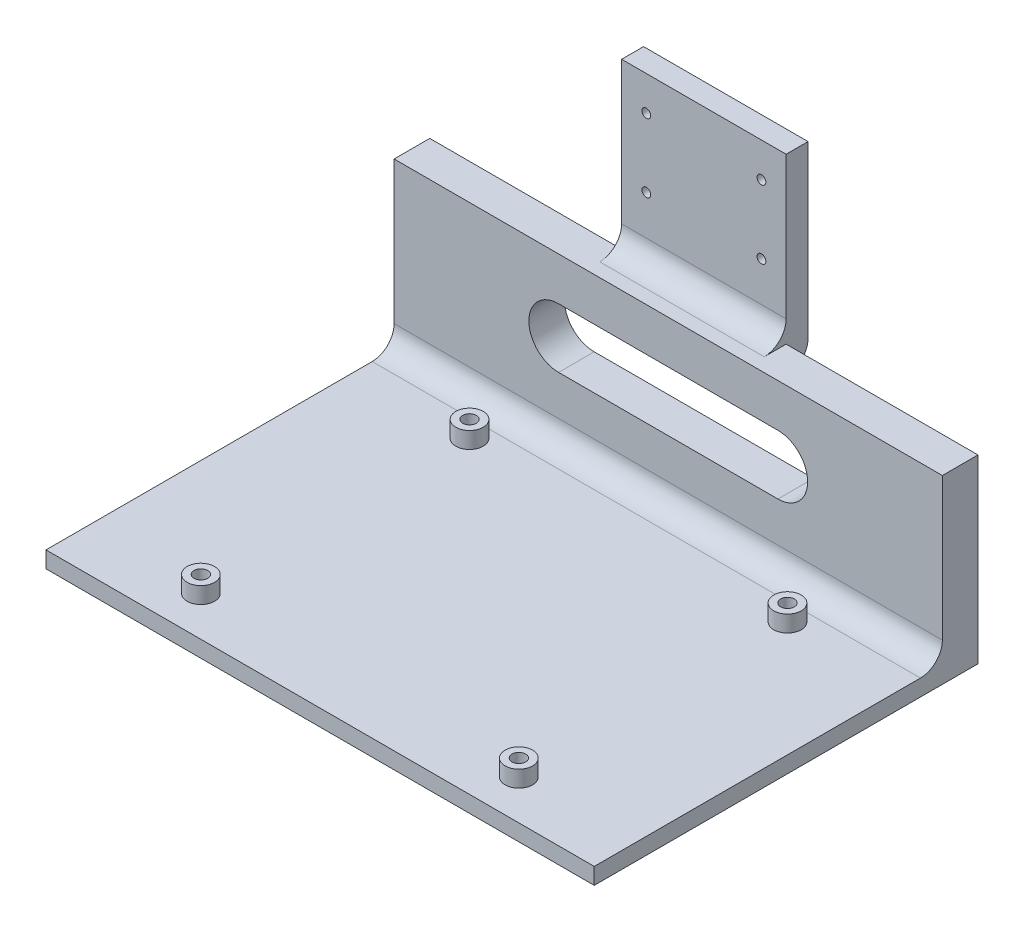
from build123d import *

# Parameters (mm, degrees)
SKETCH1_W                 = 100
SKETCH1_H                 = 70
BOSS_EXTRUDE1_DEPTH       = 3
SKETCH2_W                 = 100
SKETCH2_H                 = 6.5
BOSS_EXTRUDE2_DEPTH       = 30
SKETCH14_R                = 2.5
BOSS_EXTRUDE5_DEPTH       = 3
F_2_5MM_DOWEL_HOLE4_D     = 2.5
SKETCH21_W                = 30
SKETCH21_H                = 4
BOSS_EXTRUDE6_DEPTH       = 4
SKETCH22_W                = 30
SKETCH22_H                = 4
BOSS_EXTRUDE7_DEPTH       = 30
FILLET6_R                 = 4
FILLET7_R                 = 4
FILLET8_R                 = 4
M2X0_4_TAPPED_HOLE1_D     = 1.6
M2X0_4_TAPPED_HOLE1_DEPTH = 13
M2X0_4_TAPPED_HOLE1_TIP   = 0.480688495
FILLET9_R                 = 4
CUT_EXTRUDE10_DEPTH       = 14


with BuildPart() as part:
    # Sketch1 → Boss-Extrude1 (new body)
    with BuildSketch(Plane(origin=(0, 0, 0), x_dir=(1, 0, 0), z_dir=(0, 1, 0))):
        Rectangle(SKETCH1_W, SKETCH1_H)
    extrude(amount=BOSS_EXTRUDE1_DEPTH)

    # Sketch2 → Boss-Extrude2 (add)
    with BuildSketch(Plane(origin=(0, 3, 0), x_dir=(1, 0, 0), z_dir=(0, 1, 0))):
        with Locations((0, 31.75)):
            Rectangle(SKETCH2_W, SKETCH2_H)
    extrude(amount=BOSS_EXTRUDE2_DEPTH)

    # Sketch14 → Boss-Extrude5 (add)
    with BuildSketch(Plane(origin=(0, 3, -3), x_dir=(1, 0, 0), z_dir=(0, -1, 0))):
        with Locations(Location((-29, -18.25, 0), (0, 0, 270))):
            Circle(SKETCH14_R)
        with Locations(Location((-29, 30.75, 0), (0, 0, 270))):
            Circle(SKETCH14_R)
        with Locations(Location((29, -18.25, 0), (0, 0, 270))):
            Circle(SKETCH14_R)
        with Locations(Location((29, 30.75, 0), (0, 0, 270))):
            Circle(SKETCH14_R)
    extrude(amount=-BOSS_EXTRUDE5_DEPTH)

    # Ø2.5mm Dowel Hole4 (through all)
    with Locations(Plane(origin=(0, 6, 0), x_dir=(1, 0, 0), z_dir=(0, 1, 0))):
        with Locations((-29, 21.25), (29, 21.25), (29, -27.75), (-29, -27.75)):
            Hole(F_2_5MM_DOWEL_HOLE4_D / 2)

    # Sketch21 → Boss-Extrude6 (add)
    with BuildSketch(Plane(origin=(0, 0, -35), x_dir=(-1, 0, 0), z_dir=(0, 0, -1))):
        with Locations((0, 31)):
            Rectangle(SKETCH21_W, SKETCH21_H)
    extrude(amount=BOSS_EXTRUDE6_DEPTH)

    # Sketch22 → Boss-Extrude7 (add)
    with BuildSketch(Plane(origin=(0, 33, 0), x_dir=(1, 0, 0), z_dir=(0, 1, 0))):
        with Locations((0, 37)):
            Rectangle(SKETCH22_W, SKETCH22_H)
    extrude(amount=BOSS_EXTRUDE7_DEPTH)

    # Fillet6
    fillet6_edges = [part.edges().sort_by_distance(p)[0] for p in [
        (0, 33, -35),
    ]]
    fillet(fillet6_edges, radius=FILLET6_R)

    # Fillet7
    fillet7_edges = [part.edges().sort_by_distance(p)[0] for p in [
        (0, 29, -35),
    ]]
    fillet(fillet7_edges, radius=FILLET7_R - 0.0001)  # a hair under: the kernel refuses the full size

    # Fillet8
    fillet8_edges = [part.edges().sort_by_distance(p)[0] for p in [
        (0, 29, -39),
    ]]
    fillet(fillet8_edges, radius=FILLET8_R)

    # M2x0.4 Tapped Hole1
    with Locations(Plane(origin=(0, 0, -39), x_dir=(-1, 0, 0), z_dir=(0, 0, -1))):
        with Locations((-10.5, 56.728604695), (10.5, 56.728604695), (10.5, 44.228604695), (-10.5, 44.228604695)):
            Hole(M2X0_4_TAPPED_HOLE1_D / 2, depth=M2X0_4_TAPPED_HOLE1_DEPTH)
            with Locations((0, 0, -(M2X0_4_TAPPED_HOLE1_DEPTH + M2X0_4_TAPPED_HOLE1_TIP / 2))):  # 118° drill point
                Cone(0, M2X0_4_TAPPED_HOLE1_D / 2, M2X0_4_TAPPED_HOLE1_TIP, mode=Mode.SUBTRACT)

    # Fillet9
    fillet9_edges = [part.edges().sort_by_distance(p)[0] for p in [
        (0, 3, -28.5),
    ]]
    fillet(fillet9_edges, radius=FILLET9_R)

    # Sketch28 → Cut-Extrude10 (cut)
    with BuildSketch(Plane.XY.offset(-28.5)):
        with BuildLine():
            Line((-20, 25.135697653), (20, 25.135697653))
            ThreePointArc((20, 25.135697653), (25.424121319, 19.711576334), (20, 14.287455015))
            Line((20, 14.287455015), (-20, 14.287455015))
            ThreePointArc((-20, 14.287455015), (-25.424121319, 19.711576334), (-20, 25.135697653))
        make_face()
    extrude(amount=-CUT_EXTRUDE10_DEPTH, mode=Mode.SUBTRACT)


solid = part.part
